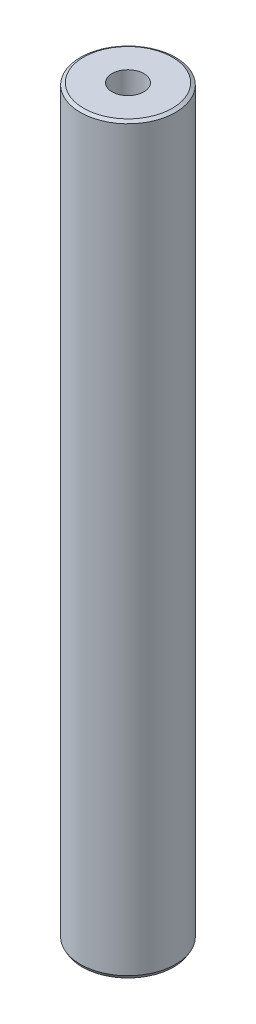
from build123d import *
from OCP.BRepFilletAPI import BRepFilletAPI_MakeChamfer

# Parameters (mm, degrees)
SKETCH1_R           = 32.5
BOSS_EXTRUDE1_DEPTH = 506.7840504
SKETCH2_R           = 10.842091136
CUT_EXTRUDE1_DEPTH  = 509.864003187
CHAMFER1_SIZE       = 1.304793387
CHAMFER1_SIZE2      = 2.259968439


with BuildPart() as part:
    # Sketch1 → Boss-Extrude1 (new body)
    with BuildSketch(Plane(origin=(0, 0, 0), x_dir=(1, 0, 0), z_dir=(0, 1, 0))):
        Circle(SKETCH1_R)
    extrude(amount=BOSS_EXTRUDE1_DEPTH)

    # Sketch2 → Cut-Extrude1 (cut, through all)
    with BuildSketch(Plane(origin=(0, 0, 0), x_dir=(1, 0, 0), z_dir=(0, 1, 0))):
        Circle(SKETCH2_R)
    extrude(amount=CUT_EXTRUDE1_DEPTH, mode=Mode.SUBTRACT)

    # Chamfer1: one chamfer whose edges measure the first distance from different faces: ONE call of the kernel's chamfer builder (chamfer() names one face for all edges)
    chamfer1_edges_1 = [part.edges().sort_by_distance(p)[0] for p in [
        (-32.5, 506.7840504, 0),
    ]]
    chamfer1_side_1 = [part.faces().sort_by_distance(p)[0] for p in [
        (-32.5, 253.3920252, 0),
    ]]
    chamfer1_edges_2 = [part.edges().sort_by_distance(p)[0] for p in [
        (-32.5, 0, 0),
    ]]
    chamfer1_side_2 = [part.faces().sort_by_distance(p)[0] for p in [
        (-31.580761184, 0, 0),
    ]]
    chamfer1 = BRepFilletAPI_MakeChamfer(part.part.solid().wrapped)
    for e in chamfer1_edges_1:
        chamfer1.Add(CHAMFER1_SIZE, CHAMFER1_SIZE2, e.wrapped, chamfer1_side_1[0].wrapped)  # the first distance lies on this face
    for e in chamfer1_edges_2:
        chamfer1.Add(CHAMFER1_SIZE, CHAMFER1_SIZE2, e.wrapped, chamfer1_side_2[0].wrapped)  # the first distance lies on this face
    add(Compound.cast(chamfer1.Shape()), mode=Mode.REPLACE)


solid = part.part
